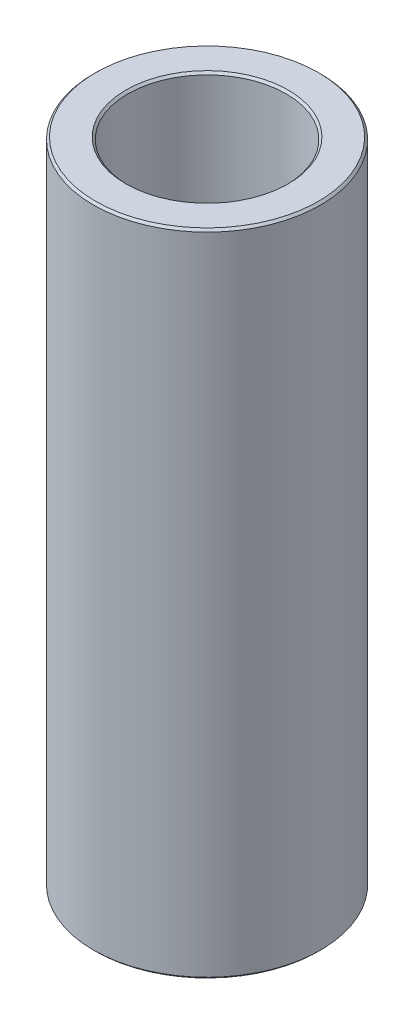
from build123d import *

# Parameters (mm, degrees)
SKETCH1_R           = 35
BOSS_EXTRUDE1_DEPTH = 200.167303581
SKETCH2_R           = 24.375295558
CUT_EXTRUDE1_DEPTH  = 207.196385572
CHAMFER1_SIZE       = 0.663652063


with BuildPart() as part:
    # Sketch1 → Boss-Extrude1 (new body)
    with BuildSketch(Plane(origin=(0, 0, 0), x_dir=(1, 0, 0), z_dir=(0, 1, 0))):
        Circle(SKETCH1_R)
    extrude(amount=BOSS_EXTRUDE1_DEPTH)

    # Sketch2 → Cut-Extrude1 (cut, through all)
    with BuildSketch(Plane(origin=(0, 0, 0), x_dir=(1, 0, 0), z_dir=(0, 1, 0))):
        Circle(SKETCH2_R)
    extrude(amount=CUT_EXTRUDE1_DEPTH, mode=Mode.SUBTRACT)

    # Chamfer1
    chamfer1_edges = [part.edges().sort_by_distance(p)[0] for p in [
        (-24.375295558, 200.167303581, 0),
        (-24.375295558, 0, 0),
        (-35, 0, 0),
        (-35, 200.167303581, 0),
    ]]
    chamfer(chamfer1_edges, length=CHAMFER1_SIZE)


solid = part.part
